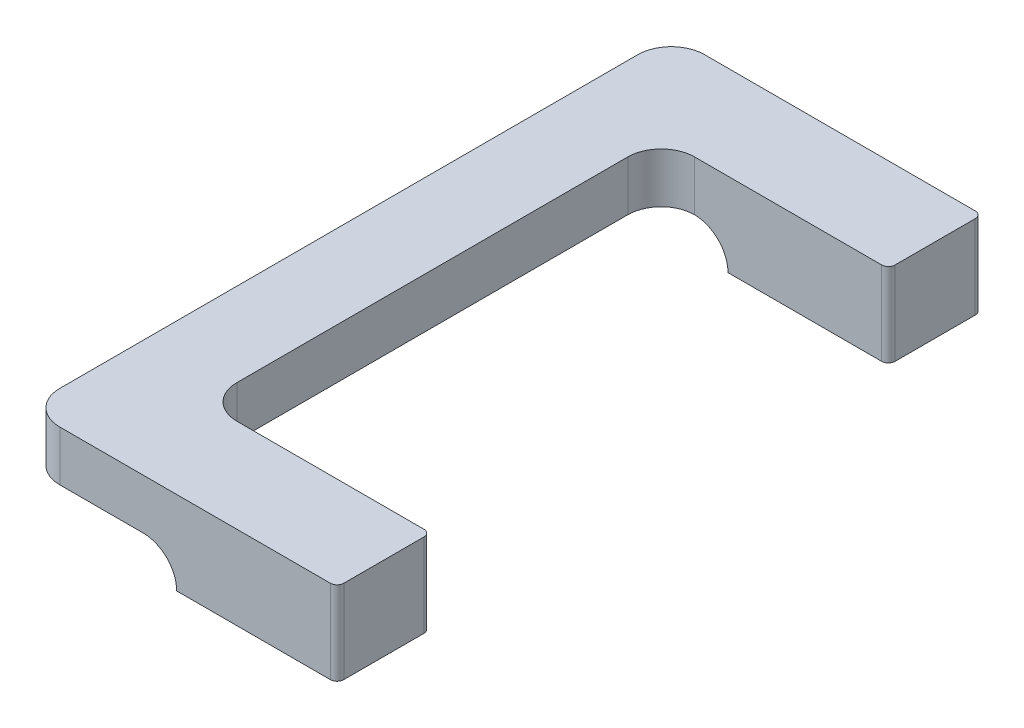
from build123d import *

# Parameters (mm, degrees)
SKETCH_1_W        = 9.6
SKETCH_1_H        = 5.6
SKETCH_1_W_2      = 8
SKETCH_1_H_2      = 4
EXTRUDE_1_DEPTH   = 5
EXTRUDE_1_2_DEPTH = 5
EXTRUDE_1_3_DEPTH = 3
SKETCH_3_W        = 8
SKETCH_3_H        = 4
EXTRUDE_2_DEPTH   = 1
FILLET_1_R        = 2
FILLET_2_R        = 0.4


with BuildPart() as part:
    # Эскиз1 → Extrude 1 (new body)
    with BuildSketch(Plane(origin=(0, 0, 0), x_dir=(1, 0, 0), z_dir=(0, 1, 0))):
        with Locations((0.747071049, 17.586951222)):
            Rectangle(SKETCH_1_W, SKETCH_1_H)
        with Locations((0.747071049, 17.586951222)):
            Rectangle(SKETCH_1_W_2, SKETCH_1_H_2, mode=Mode.SUBTRACT)
    extrude(amount=EXTRUDE_1_DEPTH)



with BuildPart() as body_2:
    # Эскиз1 → Extrude 1 2 (new body)
    with BuildSketch(Plane(origin=(0, 0, 0), x_dir=(1, 0, 0), z_dir=(0, 1, 0))):
        with Locations((0.747071049, -15.413048778)):
            Rectangle(SKETCH_1_W, SKETCH_1_H)
        with Locations((0.747071049, -15.413048778)):
            Rectangle(SKETCH_1_W_2, SKETCH_1_H_2, mode=Mode.SUBTRACT)
    extrude(amount=EXTRUDE_1_2_DEPTH)


with BuildPart() as part_1:
    add(part.part)

    add(body_2.part)  # Extrude 1 3 merges body 2
    # Эскиз2 → Extrude 1 3 (add)
    with BuildSketch(Plane(origin=(0, 5, 0), x_dir=(1, 0, 0), z_dir=(0, 1, 0))):
        Polygon((-4.052928951, 20.386951222), (-13.052928951, 20.386951222), (-13.052928951, -18.213048778), (-4.052928951, -18.213048778), (-4.052928951, -12.613048778), (-8.052928951, -12.613048778), (-8.052928951, 14.786951222), (-4.052928951, 14.786951222), align=None)
    extrude(amount=-EXTRUDE_1_3_DEPTH)

    # Эскиз3 → Бобышка-Вытянуть2 (add)
    with BuildSketch(Plane(origin=(0, 5, 0), x_dir=(1, 0, 0), z_dir=(0, 1, 0))):
        with Locations((0.747071049, 17.586951222)):
            Rectangle(SKETCH_3_W, SKETCH_3_H)
        with Locations((0.747071049, -15.413048778)):
            Rectangle(SKETCH_3_W, SKETCH_3_H)
    extrude(amount=-EXTRUDE_2_DEPTH)

    # Скругление1
    fillet_1_edges = [part_1.edges().sort_by_distance(p)[0] for p in [
        (-4.052928951, 2, -17.586951222),
        (-4.052928951, 2, 15.413048778),
        (-8.052928951, 3.5, 12.613048778),
        (-8.052928951, 3.5, -14.786951222),
        (-13.052928951, 3.5, -20.386951222),
        (-13.052928951, 3.5, 18.213048778),
    ]]
    fillet(fillet_1_edges, radius=FILLET_1_R - 0.0001)  # a hair under: the kernel refuses the full size

    # Скругление2
    fillet_2_edges = [part_1.edges().sort_by_distance(p)[0] for p in [
        (5.547071049, 2.5, 18.213048778),
        (5.547071049, 2.5, 12.613048778),
        (5.547071049, 2.5, -14.786951222),
        (5.547071049, 2.5, -20.386951222),
    ]]
    fillet(fillet_2_edges, radius=FILLET_2_R)


solid = part_1.part
